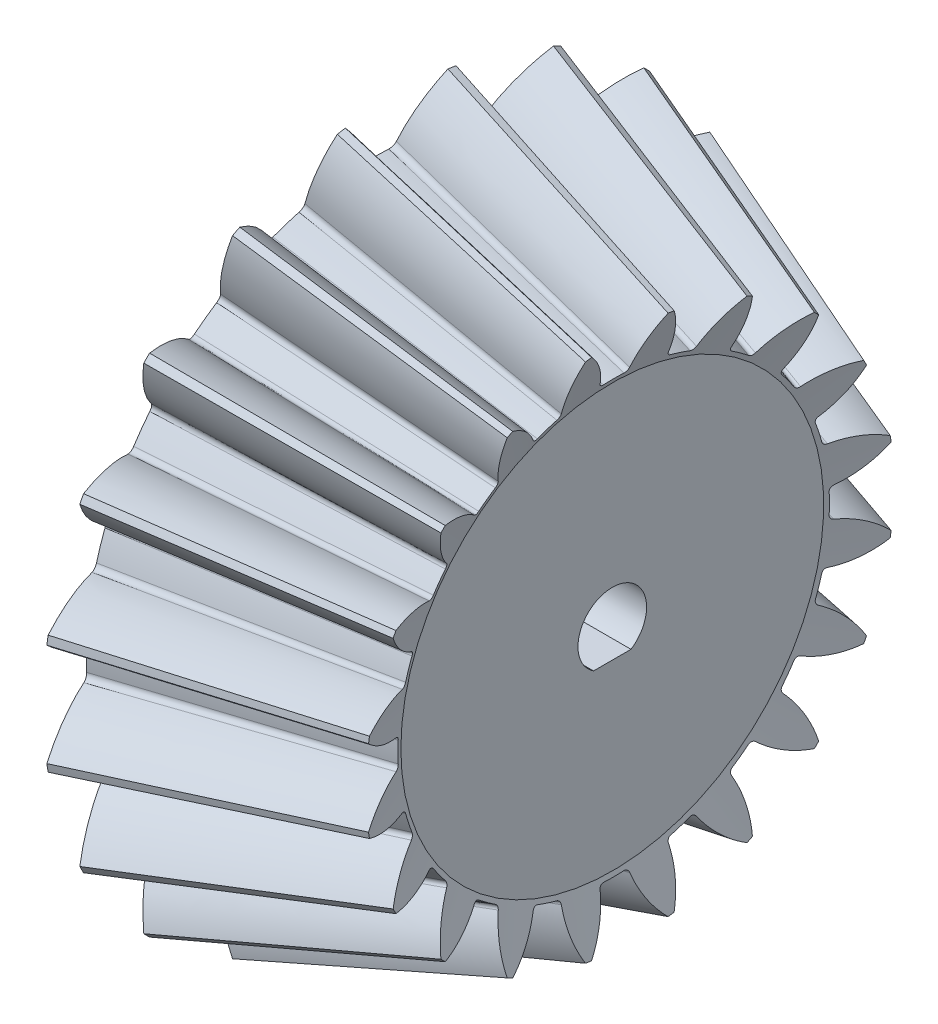
from build123d import *

# Parameters (mm, degrees)
TEETHCUTS_COUNT    = 20
TEETHCUTS_ANGLE    = 342
HUBSKE_R           = 22.689033838
HUB_DEPTH          = 0.0001016
BORSKE_R           = 0.4
BORE_DEPTH         = 75.770372854
SKETCH1_R          = 0.4
CUT_EXTRUDE2_DEPTH = 45.047133997
SKETCH2_R          = 1.5
CUT_EXTRUDE3_DEPTH = 47.159140127


with BuildPart() as part:
    # BasProSke → Base-Revolve (revolve)
    with BuildSketch(Plane(origin=(0, 0, 0), x_dir=(1, 0, 0), z_dir=(0, 1, 0)), mode=Mode.PRIVATE) as base_revolve_sk:
        Polygon((0, 0), (0, 22.689033839), (1.884146521, 28.341473394), (20.576034701, 21.171584732), (19.168543737, 16.949111845), (19.168543737, 0), align=None)
    revolve(base_revolve_sk.sketch.rotate(Axis((-10, 0, 0), (1, 0, 0)), 180), axis=Axis((-10, 0, 0), (1, 0, 0)))

    # ToothCut: read off the stored shape, not the designer's step
    # ToothCut: loft between two sections, ruled curve by curve
    toothcut_from = [
        Edge.make_bspline([(75.772803377, 0.007443966, -0.009985988), (75.771070783, 0.002246184, -0.014291159), (75.768874122, -0.004343797, -0.013743307), (75.767376366, -0.008837067, -0.00863248)], [0, 0, 0, 0, 1, 1, 1, 1], 3, [1, 0.823524486, 0.823524486, 1]),
        Edge.make_bspline([(75.767376366, -0.008837067, 0.00863248), (75.768874122, -0.004343797, 0.013743307), (75.771070783, 0.002246184, 0.014291159), (75.772803377, 0.007443966, 0.009985988)], [0, 0, 0, 0, 1, 1, 1, 1], 3, [1, 0.823524486, 0.823524486, 1]),
        Edge.make_bspline([(75.767376366, -0.008837067, -0.00863248), (75.76713751, -0.009553633, -0.007817428), (75.766934333, -0.010163167, -0.006910777), (75.766770308, -0.010655242, -0.005928032)], [0, 0, 0, 0, 1, 1, 1, 1], 3, [1, 0.994298944, 0.994298944, 1]),
        Edge.make_bspline([(75.766770308, -0.010655242, 0.005928032), (75.766934333, -0.010163167, 0.006910777), (75.76713751, -0.009553633, 0.007817428), (75.767376366, -0.008837067, 0.00863248)], [0, 0, 0, 0, 1, 1, 1, 1], 3, [1, 0.994298944, 0.994298944, 1]),
        Edge.make_bspline([(75.766770308, -0.010655242, -0.005928032), (75.76613824, -0.012551443, -0.002141048), (75.76613824, -0.012551443, 0.002141048), (75.766770308, -0.010655242, 0.005928032)], [0, 0, 0, 0, 1, 1, 1, 1], 3, [1, 0.922917684, 0.922917684, 1]),
        Edge.make_line((75.772803377, 0.007443966, 0.009985988), (75.772803377, 0.007443966, -0.009985988)),
    ]
    toothcut_to = [
        Edge.make_bspline([(1.948561339, 28.534717847, -4.604865648), (1.497174219, 27.18055649, -3.052555565), (0.917161429, 25.440518121, -2.011872354), (0.264240633, 23.481755736, -1.582786979)], [0, 0, 0, 0, 1, 1, 1, 1], 3, [1, 0.96797906, 0.96797906, 1]),
        Edge.make_bspline([(0.264240633, 23.481755736, 1.582786979), (0.917161429, 25.440518121, 2.011872354), (1.497174219, 27.18055649, 3.052555565), (1.948561339, 28.534717847, 4.604865648)], [0, 0, 0, 0, 1, 1, 1, 1], 3, [1, 0.96797906, 0.96797906, 1]),
        Edge.make_bspline([(0.264240633, 23.481755736, -1.582786979), (0.1891078, 23.256357236, -1.533411312), (0.142113175, 23.115373362, -1.341571704), (0.145772375, 23.126350963, -1.099180522)], [0, 0, 0, 0, 1, 1, 1, 1], 3, [1, 0.840296508, 0.840296508, 1]),
        Edge.make_bspline([(0.145772375, 23.126350963, 1.099180522), (0.142113175, 23.115373362, 1.341571704), (0.1891078, 23.256357236, 1.533411312), (0.264240633, 23.481755736, 1.582786979)], [0, 0, 0, 0, 1, 1, 1, 1], 3, [1, 0.840296508, 0.840296508, 1]),
        Edge.make_bspline([(0.145772375, 23.126350963, -1.099180522), (0.156830521, 23.1595254, -0.366671577), (0.156830521, 23.1595254, 0.366671577), (0.145772375, 23.126350963, 1.099180522)], [0, 0, 0, 0, 1, 1, 1, 1], 3, [1, 0.999241639, 0.999241639, 1]),
        Edge.make_line((1.948561339, 28.534717847, 4.604865648), (1.948561339, 28.534717847, -4.604865648)),
    ]
    toothcut = Solid(Shell([*[Face.make_surface_from_curves(toothcut_from[k], toothcut_to[k]) for k in range(6)], Face(Wire(toothcut_from)), Face(Wire(toothcut_to))]))
    add(toothcut, mode=Mode.SUBTRACT)

    # TeethCuts: ToothCut ×20 about axis
    teethcuts_axis = Axis((-10, 0, 0), (1, 0, 0))
    for i in range(1, TEETHCUTS_COUNT):
        add(toothcut.rotate(teethcuts_axis, i * TEETHCUTS_ANGLE / (TEETHCUTS_COUNT - 1)), mode=Mode.SUBTRACT)

    # HubSke → Hub (add)
    with BuildSketch(Plane.ZY):
        Circle(HUBSKE_R)
    extrude(amount=HUB_DEPTH)

    # BorSke → Bore (cut, symmetric)
    with BuildSketch(Plane(origin=(0, 0, 0), x_dir=(0, 0, -1), z_dir=(1, 0, 0))):
        with Locations(Location((0, 0, 0), (0, 0, 180))):
            Circle(BORSKE_R)
    extrude(amount=BORE_DEPTH, both=True, mode=Mode.SUBTRACT)

    # Sketch1 → Cut-Extrude2 (cut, through all)
    with BuildSketch(Plane(origin=(19.168543737, 0, 0), x_dir=(0, 0, -1), z_dir=(1, 0, 0))):
        with BuildLine():
            Line((-1.5, -2.304886114), (1.5, -2.304886114))
            ThreePointArc((1.5, -2.304886114), (2.417384951, -1.31101106), (2.75, 0))
            ThreePointArc((2.75, 0), (-1.31101106, 2.417384951), (-1.5, -2.304886114))
        make_face()
        Circle(SKETCH1_R, mode=Mode.SUBTRACT)
    extrude(amount=-CUT_EXTRUDE2_DEPTH, mode=Mode.SUBTRACT)

    # Sketch2 → Cut-Extrude3 (cut, through all)
    with BuildSketch(Plane(origin=(0, -2.304886114, 0), x_dir=(1, 0, 0), z_dir=(0, 1, 0))):
        with Locations(Location((9.584221068, 0, 0), (0, 0, 270))):
            Circle(SKETCH2_R)
    extrude(amount=-CUT_EXTRUDE3_DEPTH, mode=Mode.SUBTRACT)


solid = part.part
